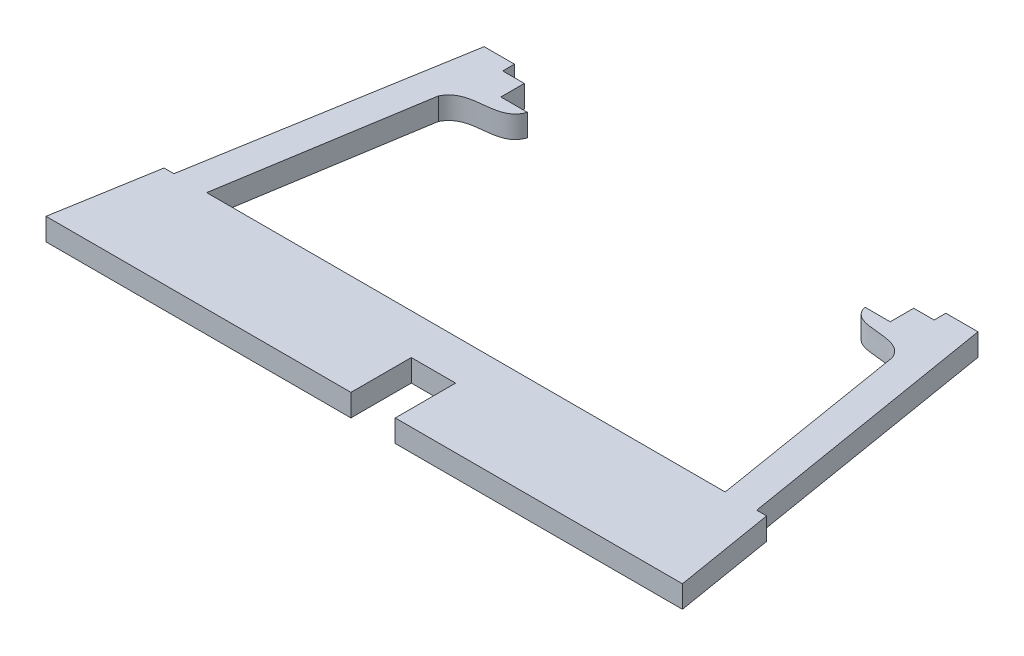
from build123d import *

# Parameters (mm, degrees)
EXTRUDE_1_DEPTH = 4


with BuildPart() as part:
    # 草图1 → 凸台-拉伸1 (new body)
    with BuildSketch(Plane(origin=(0, 0, 0), x_dir=(1, 0, 0), z_dir=(0, 1, 0))):
        with BuildLine():
            Line((16.407229691, 41.520336361), (11.607835972, 41.520336361))
            Line((11.607835972, 41.520336361), (11.607835972, 45.761661044))
            Line((11.607835972, 45.761661044), (7.701352712, 45.761661044))
            Line((7.701352712, 45.761661044), (7.701352712, 47.882323385))
            Line((7.701352712, 47.882323385), (2.232276148, 47.882323385))
            Line((2.232276148, 47.882323385), (-5.915531793, 0))
            Line((-5.915531793, 0), (-7.701352712, 0))
            Line((-7.701352712, 0), (-10.800720854, -18.214094973))
            Line((-10.800720854, -18.214094973), (44.268461459, -18.214094973))
            Line((44.268461459, -18.214094973), (44.268461459, -7.314094973))
            Line((44.268461459, -7.314094973), (52.268461459, -7.314094973))
            Line((52.268461459, -7.314094973), (52.268461459, -18.214094973))
            Line((52.268461459, -18.214094973), (104.135682326, -18.214094973))
            Line((104.135682326, -18.214094973), (101.122109526, 0))
            Line((101.122109526, 0), (99.336288607, 0))
            Line((99.336288607, 0), (91.41402469, 47.882323385))
            Line((91.41402469, 47.882323385), (85.607790294, 47.882323385))
            Line((85.607790294, 47.882323385), (85.607790294, 45.761661044))
            Line((85.607790294, 45.761661044), (81.924534649, 45.761661044))
            Line((81.924534649, 45.761661044), (81.924534649, 41.520336361))
            Line((81.924534649, 41.520336361), (77.348368544, 41.520336361))
            add(Edge.make_bspline(
                [(77.348368544, 41.520336361), (78.530765713, 36.886350927), (85.852698503, 40.714855759), (87.728452635, 36.051259798)],
                knots=[0, 0, 0, 0, 1, 1, 1, 1], degree=3))
            Line((87.728452635, 36.051259798), (93.643984428, 0))
            Line((93.643984428, 0), (0, 0))
            Line((0, 0), (5.803917986, 36.051259798))
            add(Edge.make_bspline(
                [(16.407229691, 41.520336361), (14.761303464, 36.945976328), (8.057166089, 40.477150016), (5.803917986, 36.051259798)],
                knots=[0, 0, 0, 0, 1, 1, 1, 1], degree=3))
        make_face()
    extrude(amount=EXTRUDE_1_DEPTH)


solid = part.part
